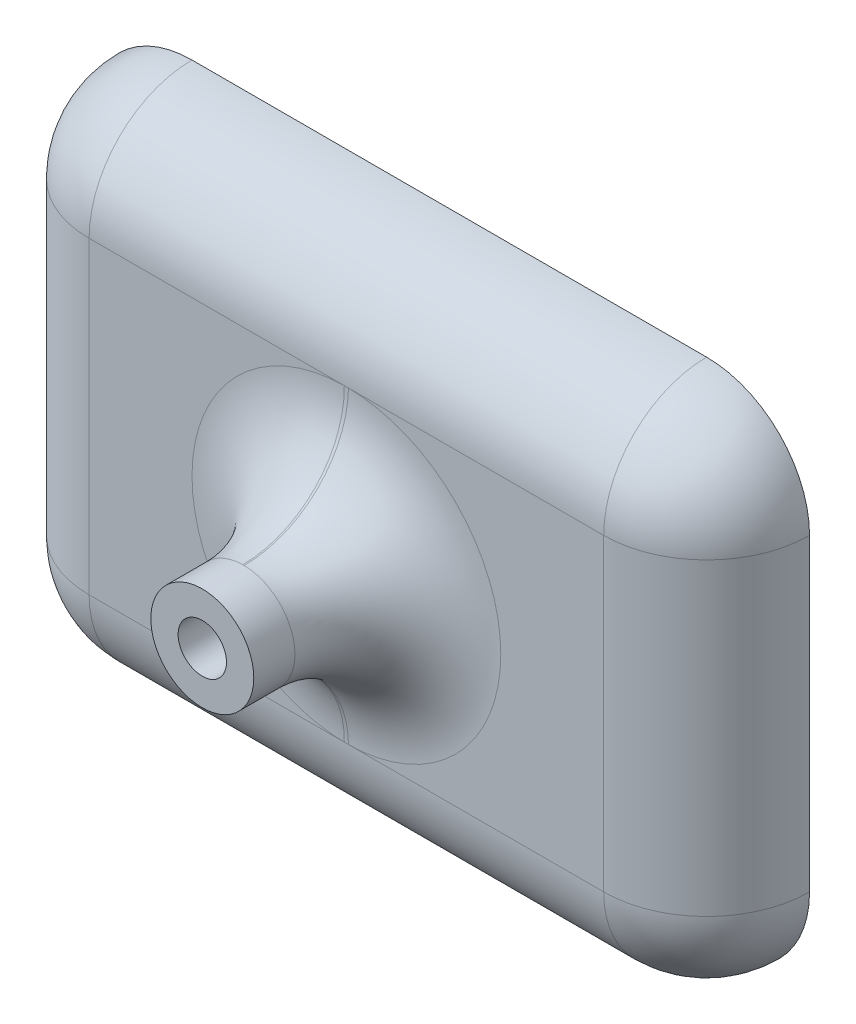
from build123d import *

# Parameters (mm, degrees)
ESBO_O1_W                = 70
ESBO_O1_H                = 50
ESBO_O1_R                = 2.35
RESSALTO_EXTRUS_O1_DEPTH = 10
ESBO_O2_R                = 5.001389376
ESBO_O2_R_2              = 2.35
RESSALTO_EXTRUS_O2_DEPTH = 24
FILETE1_R                = 10
FILETE2_R                = 10
FILETE3_R                = 10
FILETE4_R                = 10
FILETE5_R                = 10


with BuildPart() as part:
    # Esboço1 → Ressalto-extrusão1 (new body)
    with BuildSketch(Plane.XY):
        with Locations((-0.869381548, 25)):
            Rectangle(ESBO_O1_W, ESBO_O1_H)
        with Locations((-0.869381548, 25)):
            Circle(ESBO_O1_R, mode=Mode.SUBTRACT)
    extrude(amount=RESSALTO_EXTRUS_O1_DEPTH)

    # Esboço2 → Ressalto-extrusão2 (add)
    with BuildSketch(Plane.XY):
        with Locations(Location((-0.869381548, 25, 0), (0, 0, 180))):
            Circle(ESBO_O2_R)
        with Locations((-0.869381548, 25)):
            Circle(ESBO_O2_R_2, mode=Mode.SUBTRACT)
    extrude(amount=RESSALTO_EXTRUS_O2_DEPTH)

    # Filete1
    filete1_edges = [part.edges().sort_by_distance(p)[0] for p in [
        (-0.869381548, 0, 10),
    ]]
    fillet(filete1_edges, radius=FILETE1_R - 0.0001)  # a hair under: the kernel refuses the full size

    # Filete2
    filete2_edges = [part.edges().sort_by_distance(p)[0] for p in [
        (-0.869381548, 50, 10),
    ]]
    fillet(filete2_edges, radius=FILETE2_R - 0.0001)  # a hair under: the kernel refuses the full size

    # Filete3
    filete3_edges = [part.edges().sort_by_distance(p)[0] for p in [
        (-35.869381548, 2.928902899, 7.071097101),
        (-35.869381548, 25, 10),
        (-35.869381548, 47.071097101, 7.071097101),
    ]]
    fillet(filete3_edges, radius=FILETE3_R - 0.0001)  # a hair under: the kernel refuses the full size

    # Filete4
    filete4_edges = [part.edges().sort_by_distance(p)[0] for p in [
        (34.130618452, 25, 10),
        (34.130618452, 2.928902899, 7.071097101),
        (34.130618452, 47.071097101, 7.071097101),
    ]]
    fillet(filete4_edges, radius=FILETE4_R - 0.0001)  # a hair under: the kernel refuses the full size

    # Filete5
    filete5_edges = [part.edges().sort_by_distance(p)[0] for p in [
        (4.132007829, 25, 10),
    ]]
    fillet(filete5_edges, radius=FILETE5_R)


solid = part.part
